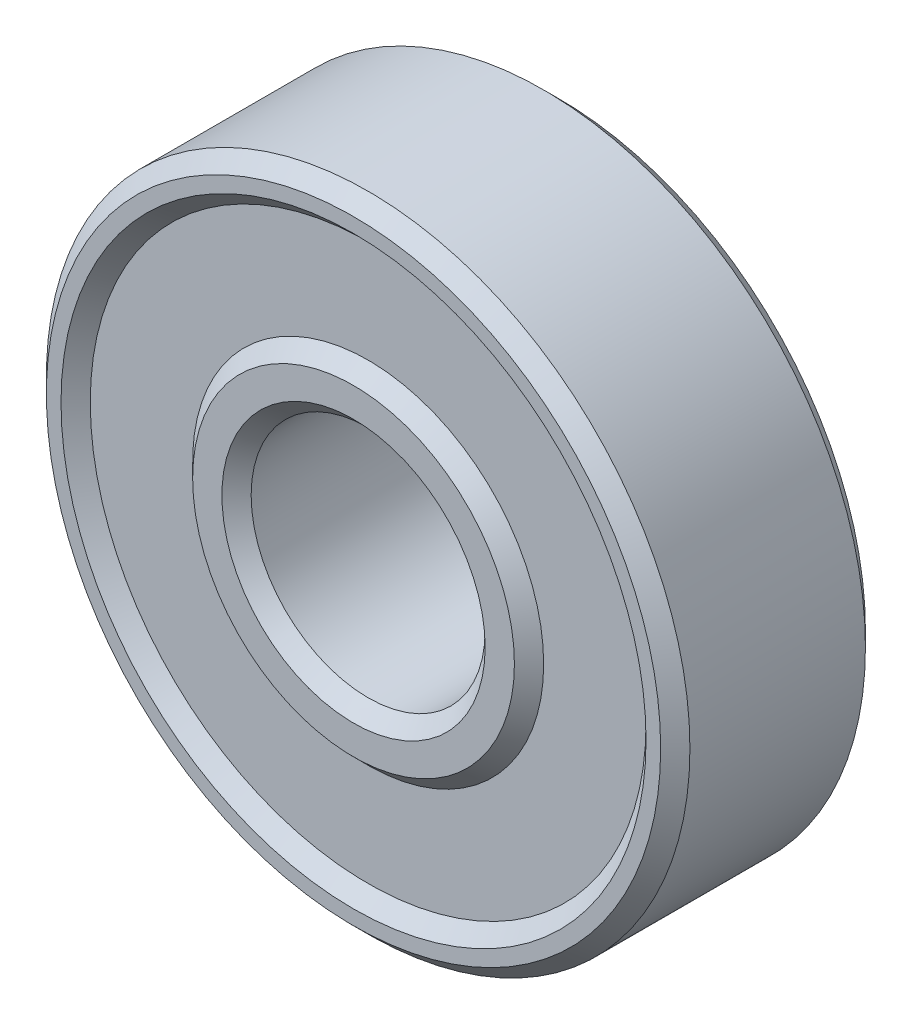
from build123d import *

# Parameters (mm, degrees)
ESQUISSE1_R             = 11
ESQUISSE1_R_2           = 4
BASE_EXTRUSION_DEPTH    = 7
ESQUISSE2_R             = 9.5
ESQUISSE2_R_2           = 6
ENL_V_MAT_EXTRU_1_DEPTH = 0.5
ENL_V_START             = -0.5
ESQUISSE3_R             = 9.5
ESQUISSE3_R_2           = 6
ENL_V_MAT_EXTRU_2_DEPTH = 0.5
CHANFREIN1_SIZE         = 0.5


with BuildPart() as part:
    # Esquisse1 → Base-Extrusion (new body)
    with BuildSketch(Plane.XY):
        Circle(ESQUISSE1_R)
        Circle(ESQUISSE1_R_2, mode=Mode.SUBTRACT)
    extrude(amount=BASE_EXTRUSION_DEPTH)

    # Esquisse2 → Enlèv. mat.-Extru.1 (cut)
    with BuildSketch(Plane.XY.offset(7)):
        Circle(ESQUISSE2_R)
        Circle(ESQUISSE2_R_2, mode=Mode.SUBTRACT)
    extrude(amount=-ENL_V_MAT_EXTRU_1_DEPTH, mode=Mode.SUBTRACT)

    # Esquisse3 → Enlèv. mat.-Extru.2 (cut)
    with BuildSketch(Plane(origin=(0, 0, 0), x_dir=(-1, 0, 0), z_dir=(0, 0, -1)).offset(ENL_V_START)):
        with Locations(Location((0, 0, 0), (0, 0, 180))):
            Circle(ESQUISSE3_R)
        with Locations(Location((0, 0, 0), (0, 0, 180))):
            Circle(ESQUISSE3_R_2, mode=Mode.SUBTRACT)
    extrude(amount=ENL_V_MAT_EXTRU_2_DEPTH, mode=Mode.SUBTRACT)

    # Chanfrein1
    chanfrein1_edges = [part.edges().sort_by_distance(p)[0] for p in [
        (-9.5, 0, 7),
        (-6, 0, 7),
        (-9.5, 0, 0),
        (-6, 0, 0),
        (-11, 0, 0),
        (-11, 0, 7),
        (-4, 0, 0),
        (-4, 0, 7),
    ]]
    chamfer(chanfrein1_edges, length=CHANFREIN1_SIZE - 0.0001)  # a hair under: the kernel refuses the full size


solid = part.part
